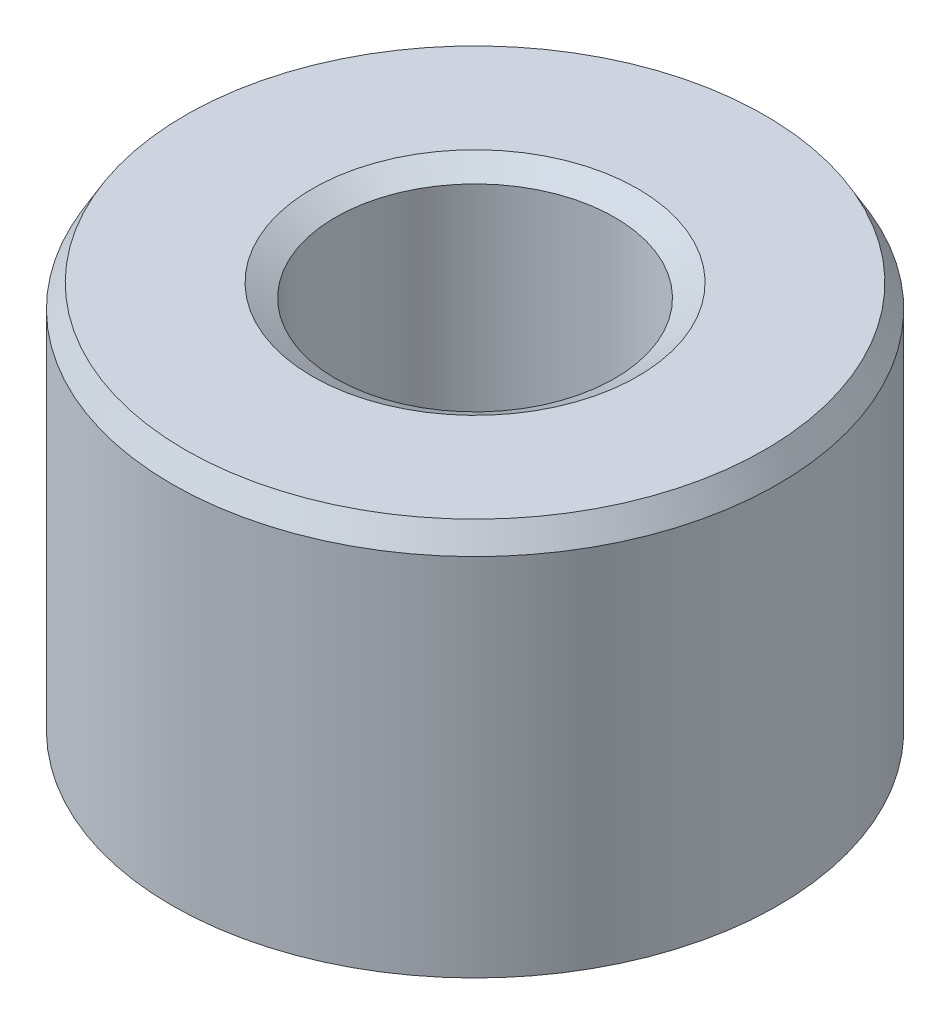
from build123d import *
from OCP.BRepFilletAPI import BRepFilletAPI_MakeChamfer

# Parameters (mm, degrees)
SKETCH1_R           = 5
BOSS_EXTRUDE1_DEPTH = 6.618814905
SKETCH2_R           = 2.303428948
CUT_EXTRUDE1_DEPTH  = 10.685489701
CHAMFER1_SIZE       = 0.379860141
CHAMFER1_SIZE2      = 0.219312355


with BuildPart() as part:
    # Sketch1 → Boss-Extrude1 (new body)
    with BuildSketch(Plane(origin=(0, 0, 0), x_dir=(1, 0, 0), z_dir=(0, 1, 0))):
        Circle(SKETCH1_R)
    extrude(amount=BOSS_EXTRUDE1_DEPTH)

    # Sketch2 → Cut-Extrude1 (cut, through all)
    with BuildSketch(Plane(origin=(0, 0, 0), x_dir=(1, 0, 0), z_dir=(0, 1, 0))):
        Circle(SKETCH2_R)
    extrude(amount=CUT_EXTRUDE1_DEPTH, mode=Mode.SUBTRACT)

    # Chamfer1: one chamfer whose edges measure the first distance from different faces: ONE call of the kernel's chamfer builder (chamfer() names one face for all edges)
    chamfer1_edges_1 = [part.edges().sort_by_distance(p)[0] for p in [
        (-2.303428948, 6.618814905, 0),
    ]]
    chamfer1_side_1 = [part.faces().sort_by_distance(p)[0] for p in [
        (-4.858578644, 6.618814905, 0),
    ]]
    chamfer1_edges_2 = [part.edges().sort_by_distance(p)[0] for p in [
        (-2.303428948, 0, 0),
    ]]
    chamfer1_side_2 = [part.faces().sort_by_distance(p)[0] for p in [
        (-2.303428948, 3.309407452, 0),
    ]]
    chamfer1_edges_3 = [part.edges().sort_by_distance(p)[0] for p in [
        (-5, 0, 0),
    ]]
    chamfer1_side_3 = [part.faces().sort_by_distance(p)[0] for p in [
        (-4.858578644, 0, 0),
    ]]
    chamfer1_edges_4 = [part.edges().sort_by_distance(p)[0] for p in [
        (-5, 6.618814905, 0),
    ]]
    chamfer1_side_4 = [part.faces().sort_by_distance(p)[0] for p in [
        (-5, 3.309407452, 0),
    ]]
    chamfer1 = BRepFilletAPI_MakeChamfer(part.part.solid().wrapped)
    for e in chamfer1_edges_1:
        chamfer1.Add(CHAMFER1_SIZE, CHAMFER1_SIZE2, e.wrapped, chamfer1_side_1[0].wrapped)  # the first distance lies on this face
    for e in chamfer1_edges_2:
        chamfer1.Add(CHAMFER1_SIZE, CHAMFER1_SIZE2, e.wrapped, chamfer1_side_2[0].wrapped)  # the first distance lies on this face
    for e in chamfer1_edges_3:
        chamfer1.Add(CHAMFER1_SIZE, CHAMFER1_SIZE2, e.wrapped, chamfer1_side_3[0].wrapped)  # the first distance lies on this face
    for e in chamfer1_edges_4:
        chamfer1.Add(CHAMFER1_SIZE, CHAMFER1_SIZE2, e.wrapped, chamfer1_side_4[0].wrapped)  # the first distance lies on this face
    add(Compound.cast(chamfer1.Shape()), mode=Mode.REPLACE)


solid = part.part
